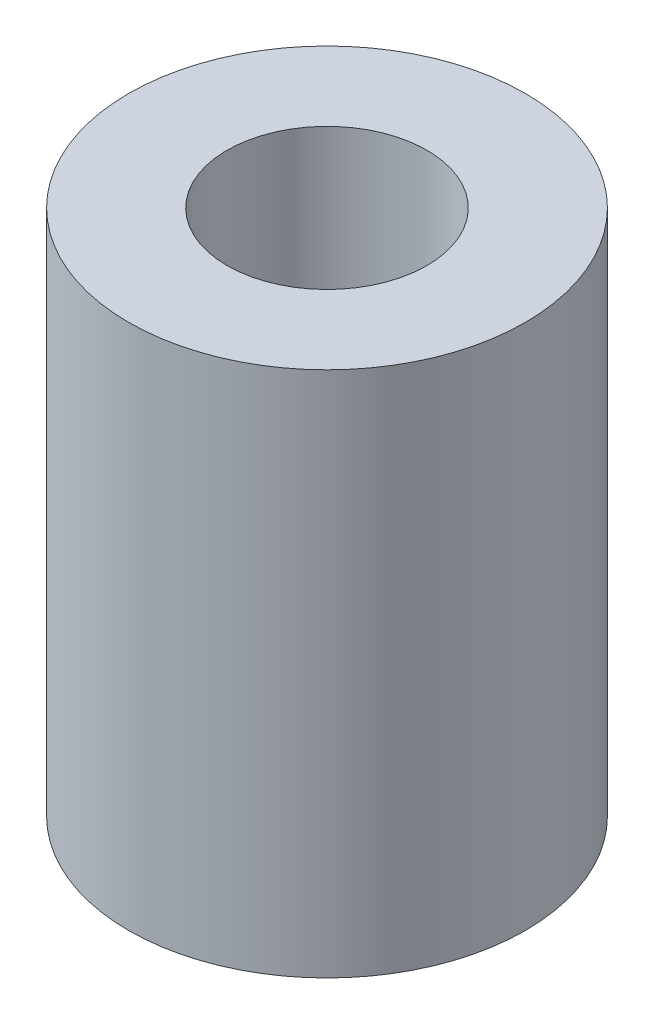
from build123d import *

# Parameters (mm, degrees)
SKETCH1_R           = 7.9375
BOSS_EXTRUDE1_DEPTH = 21.082
SKETCH3_R           = 4
CUT_EXTRUDE2_DEPTH  = 24.884273832


with BuildPart() as part:
    # Sketch1 → Boss-Extrude1 (new body)
    with BuildSketch(Plane(origin=(0, 0, 0), x_dir=(1, 0, 0), z_dir=(0, 1, 0))):
        Circle(SKETCH1_R)
    extrude(amount=BOSS_EXTRUDE1_DEPTH)

    # Sketch3 → Cut-Extrude2 (cut, through all)
    with BuildSketch(Plane(origin=(0, 21.082, 0), x_dir=(1, 0, 0), z_dir=(0, 1, 0))):
        Circle(SKETCH3_R)
    extrude(amount=-CUT_EXTRUDE2_DEPTH, mode=Mode.SUBTRACT)


solid = part.part
